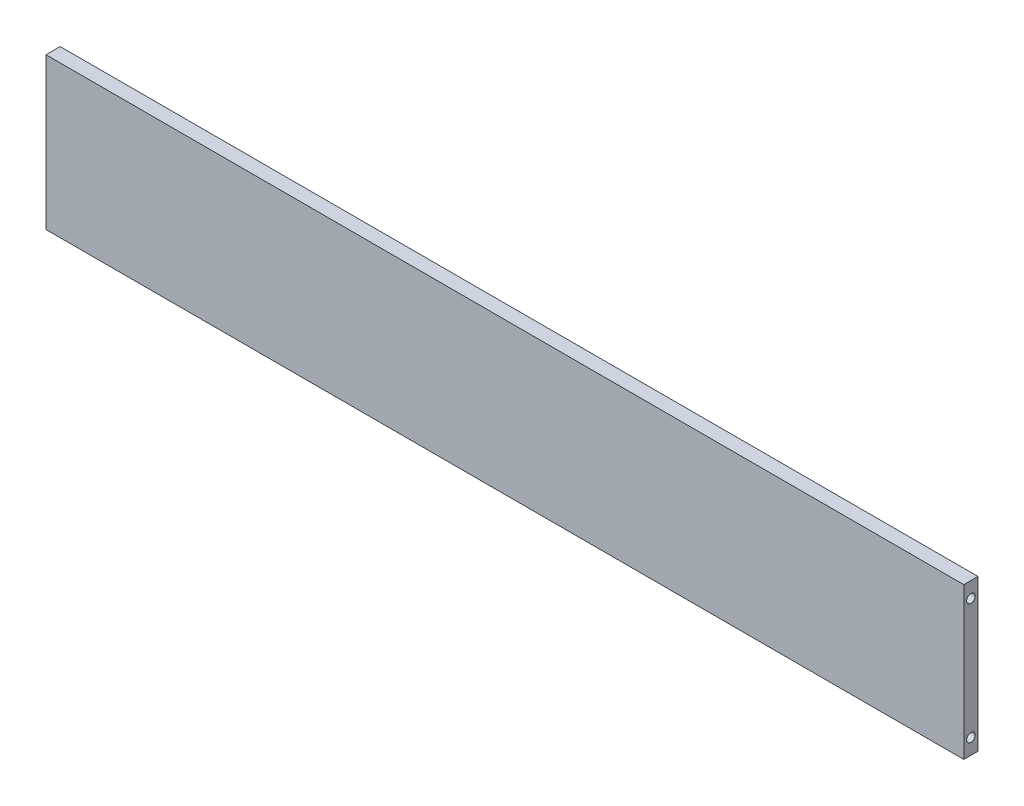
from build123d import *

# Parameters (mm, degrees)
SKETCH1_W           = 388
SKETCH1_H           = 64
BOSS_EXTRUDE1_DEPTH = 6
CUT_EXTRUDE1_REACH  = 391.364
SKETCH2_R           = 1.8


with BuildPart() as part:
    # Sketch1 → Boss-Extrude1 (new body)
    with BuildSketch(Plane.XY):
        Rectangle(SKETCH1_W, SKETCH1_H)
    extrude(amount=BOSS_EXTRUDE1_DEPTH)

    # Sketch2 → Cut-Extrude1 (cut, up to next)
    with BuildSketch(Plane.ZY.offset(194), mode=Mode.PRIVATE) as cut_extrude1_sk1:
        with Locations((3, 25.445)):
            Circle(SKETCH2_R)
    cut_extrude1_tool1 = extrude(cut_extrude1_sk1.sketch, amount=-CUT_EXTRUDE1_REACH, mode=Mode.PRIVATE) & part.part
    # Sketch2 → Cut-Extrude1 (cut, up to next)
    with BuildSketch(Plane.ZY.offset(194), mode=Mode.PRIVATE) as cut_extrude1_sk2:
        with Locations((3, -25.445)):
            Circle(SKETCH2_R)
    cut_extrude1_tool2 = extrude(cut_extrude1_sk2.sketch, amount=-CUT_EXTRUDE1_REACH, mode=Mode.PRIVATE) & part.part
    add(cut_extrude1_tool1.solids().sort_by_distance((-194, 25.445, 3))[0], mode=Mode.SUBTRACT)
    add(cut_extrude1_tool2.solids().sort_by_distance((-194, -25.445, 3))[0], mode=Mode.SUBTRACT)


solid = part.part
